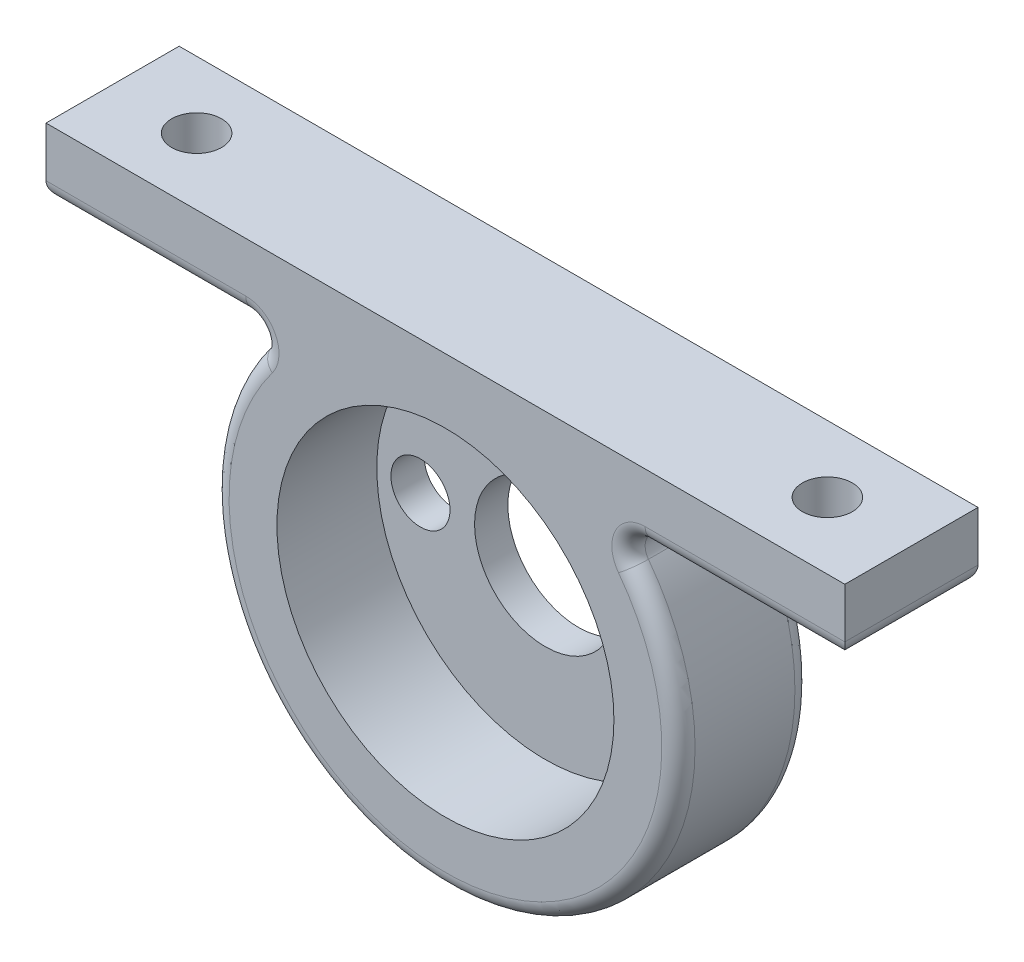
from build123d import *

# Parameters (mm, degrees)
SALIENTE_EXTRUIR1_DEPTH = 8
REDONDEO1_R             = 1
CROQUIS2_R              = 1.5
CORTAR_EXTRUIR1_DEPTH   = 35.871191617
CROQUIS3_R              = 10.125
CORTAR_EXTRUIR2_DEPTH   = 6
CROQUIS4_R              = 4.25
CROQUIS4_R_2            = 1.775
CORTAR_EXTRUIR3_DEPTH   = 29.913664638


with BuildPart() as part:
    # Croquis1 → Saliente-Extruir1 (new body)
    with BuildSketch(Plane.XY):
        with BuildLine():
            Line((0, 14), (24, 14))
            Line((24, 14), (24, 10))
            Line((24, 10), (9.797958971, 10))
            ThreePointArc((9.797958971, 10), (0, -14), (-9.797958971, 10))
            Line((-9.797958971, 10), (-24, 10))
            Line((-24, 10), (-24, 14))
            Line((-24, 14), (0, 14))
        make_face()
    extrude(amount=SALIENTE_EXTRUIR1_DEPTH)

    # Redondeo1
    redondeo1_edges = [part.edges().sort_by_distance(p)[0] for p in [
        (-16.898979486, 10, 8),
        (-16.898979486, 10, 0),
        (16.898979486, 10, 8),
        (16.898979486, 10, 0),
        (-9.797958971, 10, 4),
        (0, -14, 8),
        (9.797958971, 10, 4),
        (0, -14, 0),
        (24, 10, 4),
        (-24, 10, 4),
    ]]
    fillet(redondeo1_edges, radius=REDONDEO1_R)

    # Croquis2 → Cortar-Extruir1 (cut, through all)
    with BuildSketch(Plane.XZ.offset(-10)):
        with Locations((-18.949489743, 4)):
            Circle(CROQUIS2_R)
        with Locations((18.949489743, 4)):
            Circle(CROQUIS2_R)
    extrude(amount=-CORTAR_EXTRUIR1_DEPTH, mode=Mode.SUBTRACT)

    # Croquis3 → Cortar-Extruir2 (cut)
    with BuildSketch(Plane.XY.offset(8)):
        Circle(CROQUIS3_R)
    extrude(amount=-CORTAR_EXTRUIR2_DEPTH, mode=Mode.SUBTRACT)

    # Croquis4 → Cortar-Extruir3 (cut, through all)
    with BuildSketch(Plane(origin=(0, 0, 0), x_dir=(-1, 0, 0), z_dir=(0, 0, -1))):
        Circle(CROQUIS4_R)
        with Locations((7.5, 0)):
            Circle(CROQUIS4_R_2)
        with Locations((-7.5, 0)):
            Circle(CROQUIS4_R_2)
    extrude(amount=-CORTAR_EXTRUIR3_DEPTH, mode=Mode.SUBTRACT)


solid = part.part
